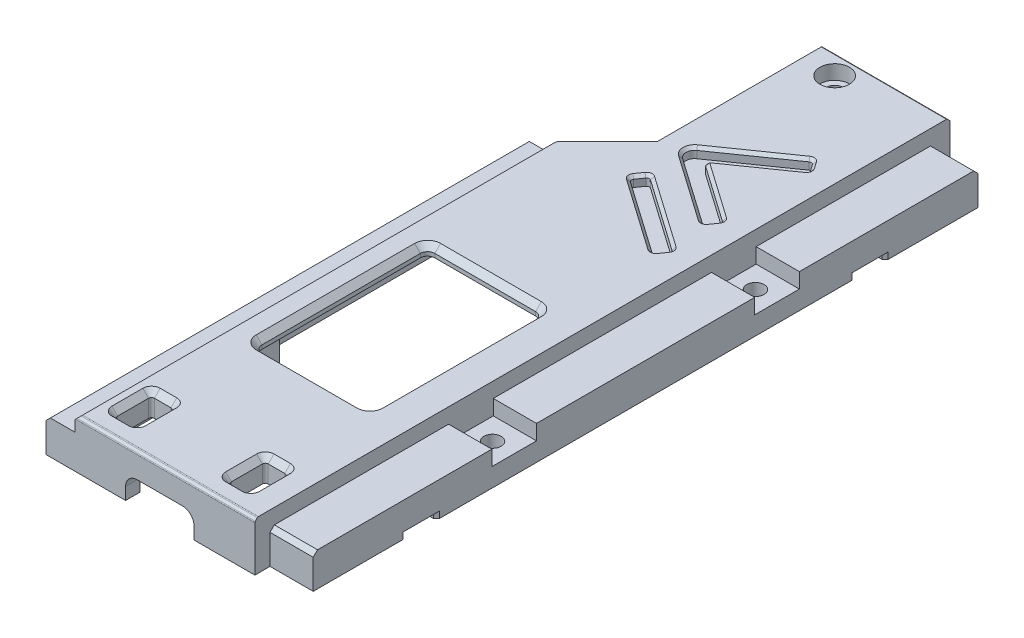
from build123d import *

# Parameters (mm, degrees)
SKETCH_1_W                 = 35
SKETCH_1_H                 = 96.5
EXTRUDE_1_DEPTH            = 6.8
CUT_EXTRUDE_6_DEPTH        = 3.4
CUT_EXTRUDE_7_REACH        = 104.876
SKETCH_13_W                = 16
SKETCH_13_H                = 24
CUT_EXTRUDE_9_DEPTH        = 10
CUT_EXTRUDE_17_REACH       = 104.876
SKETCH_24_W                = 3.1
SKETCH_24_H                = 5.1
CUT_EXTRUDE_21_DEPTH       = 103.707399928
CUT_EXTRUDE_21_DEPTH_BACK  = 0.18
SKETCH_25_W                = 5.5
SKETCH_25_H                = 7.5
SKETCH_25_W_2              = 3.1
SKETCH_25_H_2              = 5.1
FILLET_3_R                 = 0.4
CHAMFER_2_SIZE             = 0.8
FILLET_4_R                 = 1
CHAMFER_1_SIZE             = 0.8
CUT_EXTRUDE_18_REACH       = 104.876
SKETCH_28_W                = 4
SKETCH_28_H                = 66.5
CUT_EXTRUDE_19_DEPTH       = 2.1
FILLET_5_R                 = 1
CHAMFER_3_SIZE             = 0.6
CUT_EXTRUDE_20_DEPTH       = 2.06
CHAMFER_4_SIZE             = 0.6
CUT_EXTRUDE_22_DEPTH       = 4
CUT_EXTRUDE_23_DEPTH       = 1.4
FILLET_6_R                 = 0.4
FILLET_7_R                 = 1.2
CHAMFER_5_SIZE             = 0.4
CUT_EXTRUDE_24_DEPTH       = 6
CHAMFER_6_SIZE             = 0.6
CHAMFER_7_SIZE             = 0.4
FILLET_8_R                 = 0.2
SKETCH_36_W                = 6.2
SKETCH_36_H                = 2.1
CUT_EXTRUDE_27_DEPTH       = 6
CUT_EXTRUDE_28_DEPTH       = 0.9
SKETCH_38_R                = 1.2
CUT_EXTRUDE_29_DEPTH       = 103.736994311
SKETCH_39_R                = 1.2
CUT_EXTRUDE_30_DEPTH       = 103.876090517
CUT_EXTRUDE_START          = 4.8
CUT_EXTRUDE_31_OUTLINE_R   = 2.05
CUT_EXTRUDE_31_OUTLINE_R_2 = 1.2
CUT_EXTRUDE_31_DEPTH       = 2


# Read off the part's stored shape, not the designer's step: 切除-拉伸31
with BuildPart() as part:
    # 草图1 → 凸台-拉伸1 (new body)
    with BuildSketch(Plane(origin=(0, 0, 0), x_dir=(1, 0, 0), z_dir=(0, 1, 0))):
        with Locations((17.5, 48.25)):
            Rectangle(SKETCH_1_W, SKETCH_1_H)
    extrude(amount=EXTRUDE_1_DEPTH)

    # 草图10 → 切除-拉伸6 (cut)
    with BuildSketch(Plane.XZ):
        Polygon((3, -57.9), (3, -27), (5.4, -27), (5.4, -20), (3, -20), (3, -2), (26.2, -2), (26.2, -57.9), align=None)
    extrude(amount=-CUT_EXTRUDE_6_DEPTH, mode=Mode.SUBTRACT)

    # 草图11 → 切除-拉伸7 (cut, up to next)
    with BuildSketch(Plane.XY, mode=Mode.PRIVATE) as cut_extrude_7_sk1:
        with BuildLine():
            Line((11.05, 0), (20.55, 0))
            Line((20.55, 0), (20.55, 1.7))
            ThreePointArc((20.55, 1.7), (20.08137085, 2.83137085), (18.95, 3.3))
            Line((18.95, 3.3), (12.65, 3.3))
            ThreePointArc((12.65, 3.3), (11.51862915, 2.83137085), (11.05, 1.7))
            Line((11.05, 1.7), (11.05, 0))
        make_face()
    cut_extrude_7_tool1 = extrude(cut_extrude_7_sk1.sketch, amount=-CUT_EXTRUDE_7_REACH, mode=Mode.PRIVATE) & part.part
    add(cut_extrude_7_tool1.solids().sort_by_distance((15.8, 1.603051, 0))[0], mode=Mode.SUBTRACT)

    # 草图13 → 切除-拉伸9 (cut)
    with BuildSketch(Plane.XZ.offset(-3.4)):
        with Locations((15.8, -33.18)):
            Rectangle(SKETCH_13_W, SKETCH_13_H)
    extrude(amount=-CUT_EXTRUDE_9_DEPTH, mode=Mode.SUBTRACT)

    # 草图24 → 切除-拉伸17 (cut, up to next)
    with BuildSketch(Plane(origin=(0, 6.8, 0), x_dir=(1, 0, 0), z_dir=(0, 1, 0)), mode=Mode.PRIVATE) as cut_extrude_17_sk1:
        with Locations((7.9, 5.75)):
            Rectangle(SKETCH_24_W, SKETCH_24_H)
    cut_extrude_17_tool1 = extrude(cut_extrude_17_sk1.sketch, amount=-CUT_EXTRUDE_17_REACH, mode=Mode.PRIVATE) & part.part
    # 草图24 → 切除-拉伸17 (cut, up to next)
    with BuildSketch(Plane(origin=(0, 6.8, 0), x_dir=(1, 0, 0), z_dir=(0, 1, 0)), mode=Mode.PRIVATE) as cut_extrude_17_sk2:
        with Locations((23.7, 5.75)):
            Rectangle(SKETCH_24_W, SKETCH_24_H)
    cut_extrude_17_tool2 = extrude(cut_extrude_17_sk2.sketch, amount=-CUT_EXTRUDE_17_REACH, mode=Mode.PRIVATE) & part.part
    add(cut_extrude_17_tool1.solids().sort_by_distance((7.9, 6.8, -5.75))[0], mode=Mode.SUBTRACT)
    add(cut_extrude_17_tool2.solids().sort_by_distance((23.7, 6.8, -5.75))[0], mode=Mode.SUBTRACT)

    # 草图25 → 切除-拉伸21 (cut, two sides: drawn at the far end of the back side and taken through both)
    # profile 1 of 2: a face of its own
    with BuildSketch(Plane.XZ.offset(-3.4).offset(-CUT_EXTRUDE_21_DEPTH_BACK)):
        with Locations((23.7, -5.75)):
            Rectangle(SKETCH_25_W, SKETCH_25_H)
        with Locations((23.7, -5.75)):
            Rectangle(SKETCH_25_W_2, SKETCH_25_H_2, mode=Mode.SUBTRACT)
    # profile 2 of 2: a face of its own
    with BuildSketch(Plane.XZ.offset(-3.4).offset(-CUT_EXTRUDE_21_DEPTH_BACK)):
        with Locations((7.9, -5.75)):
            Rectangle(SKETCH_25_W, SKETCH_25_H)
        with Locations((7.9, -5.75)):
            Rectangle(SKETCH_25_W_2, SKETCH_25_H_2, mode=Mode.SUBTRACT)
    extrude(amount=CUT_EXTRUDE_21_DEPTH + CUT_EXTRUDE_21_DEPTH_BACK, mode=Mode.SUBTRACT)

    # 圆角3
    fillet_3_edges = [part.edges().sort_by_distance(p)[0] for p in [
        (6.35, 5.19, -3.2),
        (9.45, 5.19, -3.2),
        (9.45, 5.19, -8.3),
        (6.35, 5.19, -8.3),
        (22.15, 5.19, -3.2),
        (25.25, 5.19, -3.2),
        (25.25, 5.19, -8.3),
        (22.15, 5.19, -8.3),
    ]]
    fillet(fillet_3_edges, radius=FILLET_3_R)

    # 倒角2
    chamfer_2_edges = [part.edges().sort_by_distance(p)[0] for p in [
        (23.7, 6.8, -8.3),
        (25.25, 6.8, -5.75),
        (23.7, 6.8, -3.2),
        (22.15, 6.8, -5.75),
        (7.9, 6.8, -8.3),
        (9.45, 6.8, -5.75),
        (7.9, 6.8, -3.2),
        (6.35, 6.8, -5.75),
        (25.132842712, 6.8, -8.182842712),
        (25.132842712, 6.8, -3.317157288),
        (22.267157288, 6.8, -3.317157288),
        (22.267157288, 6.8, -8.182842712),
        (9.332842712, 6.8, -8.182842712),
        (9.332842712, 6.8, -3.317157288),
        (6.467157288, 6.8, -3.317157288),
        (6.467157288, 6.8, -8.182842712),
    ]]
    chamfer(chamfer_2_edges, length=CHAMFER_2_SIZE)

    # 圆角4
    fillet_4_edges = [part.edges().sort_by_distance(p)[0] for p in [
        (7.8, 5.1, -45.18),
        (7.8, 5.1, -21.18),
        (23.8, 5.1, -21.18),
        (23.8, 5.1, -45.18),
    ]]
    fillet(fillet_4_edges, radius=FILLET_4_R)

    # 倒角1
    chamfer_1_edges = [part.edges().sort_by_distance(p)[0] for p in [
        (15.8, 6.8, -21.18),
        (23.8, 6.8, -33.18),
        (15.8, 6.8, -45.18),
        (7.8, 6.8, -33.18),
        (23.507106781, 6.8, -21.472893219),
        (23.507106781, 6.8, -44.887106781),
        (8.092893219, 6.8, -44.887106781),
        (8.092893219, 6.8, -21.472893219),
    ]]
    chamfer(chamfer_1_edges, length=CHAMFER_1_SIZE)

    # 草图26 → 切除-拉伸18 (cut, up to next)
    with BuildSketch(Plane(origin=(0, 6.8, 0), x_dir=(1, 0, 0), z_dir=(0, 1, 0)), mode=Mode.PRIVATE) as cut_extrude_18_sk1:
        Polygon((4, 66.5), (11, 73.5), (11, 96.5), (0, 96.5), (0, 66.5), align=None)
    cut_extrude_18_tool1 = extrude(cut_extrude_18_sk1.sketch, amount=-CUT_EXTRUDE_18_REACH, mode=Mode.PRIVATE) & part.part
    add(cut_extrude_18_tool1.solids().sort_by_distance((5.246045, 6.8, -82.515821))[0], mode=Mode.SUBTRACT)

    # 草图28 → 切除-拉伸19 (cut)
    with BuildSketch(Plane(origin=(0, 6.8, 0), x_dir=(1, 0, 0), z_dir=(0, 1, 0))):
        with Locations((2, 33.25)):
            Rectangle(SKETCH_28_W, SKETCH_28_H)
    extrude(amount=-CUT_EXTRUDE_19_DEPTH, mode=Mode.SUBTRACT)

    # 圆角5
    fillet_5_edges = [part.edges().sort_by_distance(p)[0] for p in [
        (4, 5.75, -66.5),
    ]]
    fillet(fillet_5_edges, radius=FILLET_5_R)

    # 倒角3
    chamfer_3_edges = [part.edges().sort_by_distance(p)[0] for p in [
        (11, 6.8, -85),
        (4, 6.8, -33.042893219),
        (7.646446609, 6.8, -70.146446609),
        (4.076120467, 6.8, -66.46846987),
    ]]
    chamfer(chamfer_3_edges, length=CHAMFER_3_SIZE)

    # 草图29 → 切除-拉伸20 (cut)
    with BuildSketch(Plane.XZ.offset(-3.4)):
        with BuildLine():
            Line((26.10000124, -48.17900104), (26.10000124, -18.17900104))
            ThreePointArc((26.10000124, -18.17900104), (25.367768193, -16.411234087), (23.60000124, -15.67900104))
            Line((23.60000124, -15.67900104), (8.00000124, -15.67900104))
            ThreePointArc((8.00000124, -15.67900104), (6.232234287, -16.411234087), (5.50000124, -18.17900104))
            Line((5.50000124, -18.17900104), (5.50000124, -48.17900104))
            ThreePointArc((5.50000124, -48.17900104), (6.232234287, -49.946767993), (8.00000124, -50.67900104))
            Line((8.00000124, -50.67900104), (23.60000124, -50.67900104))
            ThreePointArc((23.60000124, -50.67900104), (25.367768193, -49.946767993), (26.10000124, -48.17900104))
        make_face()
    extrude(amount=-CUT_EXTRUDE_20_DEPTH, mode=Mode.SUBTRACT)

    # 倒角4
    chamfer_4_edges = [part.edges().sort_by_distance(p)[0] for p in [
        (11, 0, -85),
        (0, 4.7, -33.25),
    ]]
    chamfer(chamfer_4_edges, length=CHAMFER_4_SIZE)

    # 草图30 → 切除-拉伸22 (cut)
    with BuildSketch(Plane.XZ):
        Polygon((28.6, -88.5), (27.2, -88.5), (27.2, -78.5), (28.6, -78.5), (28.6, -57.9), (3, -57.9), (3, -78.5), (12.5, -78.5), (13.9, -78.5), (13.9, -88.5), (12.5, -88.5), (12.5, -90.5), (28.6, -90.5), align=None)
    extrude(amount=-CUT_EXTRUDE_22_DEPTH, mode=Mode.SUBTRACT)

    # 草图31 → 切除-拉伸23 (cut)
    with BuildSketch(Plane(origin=(0, 6.8, 0), x_dir=(1, 0, 0), z_dir=(0, 1, 0))):
        Polygon((24.512847127, 59.723391823), (25.66, 61.361695911), (15.011023424, 68.818189584), (13.863870552, 67.179885495), align=None)
        Polygon((24.512847127, 66.723391823), (13.604218368, 74.361695911), (24.512847127, 82), (25.66, 80.361695911), (17.09111196, 74.361695911), (25.66, 68.361695911), align=None)
    extrude(amount=-CUT_EXTRUDE_23_DEPTH, mode=Mode.SUBTRACT)

    # 圆角6
    fillet_6_edges = [part.edges().sort_by_distance(p)[0] for p in [
        (24.512847127, 6.1, -59.723391823),
        (13.863870552, 6.1, -67.179885495),
        (15.011023424, 6.1, -68.818189584),
        (25.66, 6.1, -61.361695911),
        (25.66, 6.1, -68.361695911),
        (24.512847127, 6.1, -66.723391823),
        (24.512847127, 6.1, -82),
        (25.66, 6.1, -80.361695911),
        (17.09111196, 6.1, -74.361695911),
    ]]
    fillet(fillet_6_edges, radius=FILLET_6_R)

    # 圆角7
    fillet_7_edges = [part.edges().sort_by_distance(p)[0] for p in [
        (13.604218368, 6.1, -74.361695911),
    ]]
    fillet(fillet_7_edges, radius=FILLET_7_R)

    # 倒角5
    chamfer_5_edges = [part.edges().sort_by_distance(p)[0] for p in [
        (20.335511712, 6.8, -65.089942748),
        (25.086423564, 6.8, -60.542543867),
        (19.188358839, 6.8, -63.451638659),
        (14.437446988, 6.8, -67.99903754),
        (25.086423564, 6.8, -81.180847956),
        (21.445699643, 6.8, -77.410811033),
        (19.596624555, 6.8, -78.557623895),
        (21.445699643, 6.8, -71.31258079),
        (25.086423564, 6.8, -67.542543867),
        (17.388490678, 6.8, -74.361695911),
        (25.496831709, 6.8, -61.332924939),
        (24.484076155, 6.8, -59.886560114),
        (15.039794396, 6.8, -68.655021293),
        (14.027038843, 6.8, -67.208656468),
        (25.496831709, 6.8, -80.390466884),
        (24.484076155, 6.8, -81.836831709),
        (25.496831709, 6.8, -68.332924939),
        (24.484076155, 6.8, -66.886560114),
        (19.596624555, 6.8, -70.165767928),
        (14.496354523, 6.8, -74.361695911),
    ]]
    chamfer(chamfer_5_edges, length=CHAMFER_5_SIZE)

    # 草图32 → 切除-拉伸24 (cut)
    with BuildSketch(Plane(origin=(35, 0, 0), x_dir=(0, 0, -1), z_dir=(1, 0, 0))):
        Polygon((96.5, 6.8), (96.5, 0), (94.4, 0), (94.4, 4.7), (2.1, 4.7), (2.1, 0), (0, 0), (0, 6.8), align=None)
    extrude(amount=-CUT_EXTRUDE_24_DEPTH, mode=Mode.SUBTRACT)

    # 倒角6
    chamfer_6_edges = [part.edges().sort_by_distance(p)[0] for p in [
        (32, 4.7, -94.4),
        (32, 4.7, -2.1),
    ]]
    chamfer(chamfer_6_edges, length=CHAMFER_6_SIZE)

    # 倒角7
    chamfer_7_edges = [part.edges().sort_by_distance(p)[0] for p in [
        (16.8, 6.8, 0),
        (20.3, 6.8, -96.5),
    ]]
    chamfer(chamfer_7_edges, length=CHAMFER_7_SIZE)

    # 圆角8
    fillet_8_edges = [part.edges().sort_by_distance(p)[0] for p in [
        (16.8, 6.8, -0.4),
        (20.3, 6.8, -96.1),
        (20.1, 6.4, -96.5),
        (16.6, 6.4, 0),
    ]]
    fillet(fillet_8_edges, radius=FILLET_8_R)

    # 草图36 → 切除-拉伸27 (cut)
    with BuildSketch(Plane(origin=(35, 0, 0), x_dir=(0, 0, -1), z_dir=(1, 0, 0))):
        with Locations((30, 3.65)):
            Rectangle(SKETCH_36_W, SKETCH_36_H)
        with Locations((66.5, 3.65)):
            Rectangle(SKETCH_36_W, SKETCH_36_H)
    extrude(amount=-CUT_EXTRUDE_27_DEPTH, mode=Mode.SUBTRACT)

    # 草图37 → 切除-拉伸28 (cut)
    with BuildSketch(Plane.XZ):
        Polygon((35, -14.6), (35, -19.6), (34.6, -19.2), (33, -19.2), (31, -21.2), (30.8, -21.2), (30.8, -13), (31, -13), (33, -15), (34.6, -15), align=None)
        Polygon((35, -76.9), (35, -81.9), (34.6, -81.5), (33, -81.5), (31, -83.5), (30.8, -83.5), (30.8, -75.3), (31, -75.3), (33, -77.3), (34.6, -77.3), align=None)
    extrude(amount=-CUT_EXTRUDE_28_DEPTH, mode=Mode.SUBTRACT)

    # 草图38 → 切除-拉伸29 (cut, through all)
    with BuildSketch(Plane(origin=(0, 2.6, 0), x_dir=(1, 0, 0), z_dir=(0, 1, 0))):
        with Locations(Location((32, 30, 0), (0, 0, 270))):
            Circle(SKETCH_38_R)
        with Locations(Location((32, 66.5, 0), (0, 0, 270))):
            Circle(SKETCH_38_R)
    extrude(amount=-CUT_EXTRUDE_29_DEPTH, mode=Mode.SUBTRACT)

    # 草图39 → 切除-拉伸30 (cut, through all)
    with BuildSketch(Plane(origin=(0, 6.8, 0), x_dir=(1, 0, 0), z_dir=(0, 1, 0))):
        with Locations(Location((16, 93.5, 0), (0, 0, 270))):
            Circle(SKETCH_39_R)
    extrude(amount=-CUT_EXTRUDE_30_DEPTH, mode=Mode.SUBTRACT)

    # 切除-拉伸31 outline → 切除-拉伸31 (cut)
    with BuildSketch(Plane(origin=(0, 0, 0), x_dir=(1, 0, 0), z_dir=(0, 1, 0)).offset(CUT_EXTRUDE_START)):
        with Locations((16, 93.5)):
            Circle(CUT_EXTRUDE_31_OUTLINE_R)
        with Locations((16, 93.5)):
            Circle(CUT_EXTRUDE_31_OUTLINE_R_2, mode=Mode.SUBTRACT)
    extrude(amount=CUT_EXTRUDE_31_DEPTH, mode=Mode.SUBTRACT)


solid = part.part
